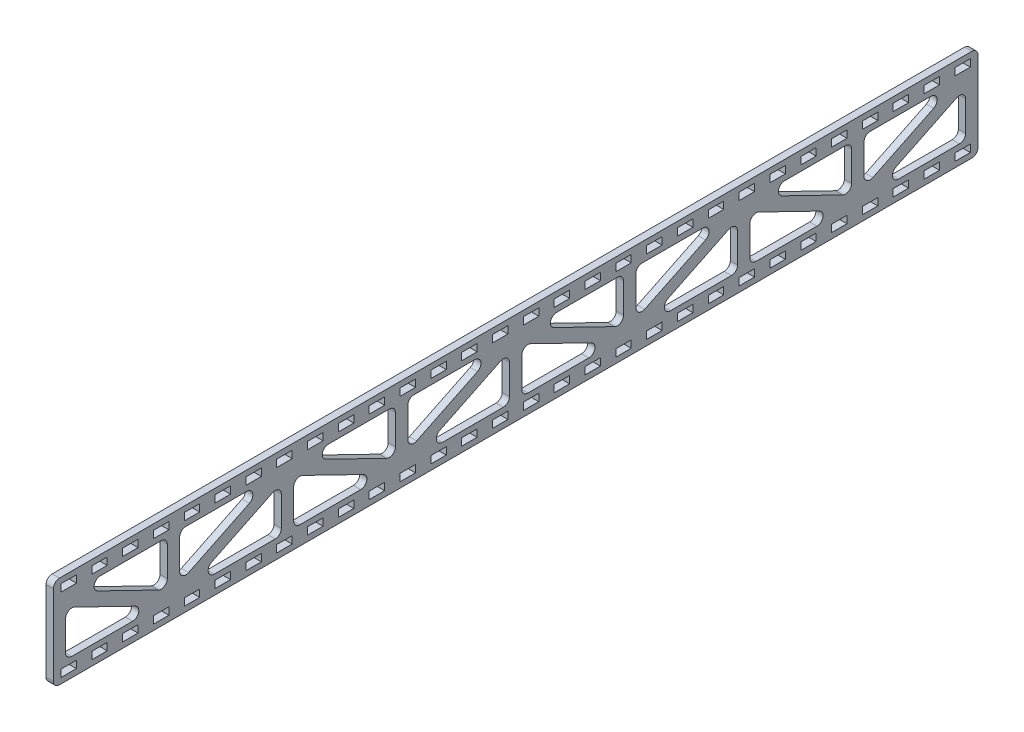
from build123d import *

# Parameters (mm, degrees)
SKETCH1_W          = 381
SKETCH1_H          = 38.1
OUTER_CUT_DEPTH    = 1.4986
CUT_EXTRUDE1_DEPTH = 192.473590105
FILLET1_R          = 2.54
SKETCH2_W          = 6.35
SKETCH2_H          = 3
SLOT_DEPTH         = 192.473590105
SLOTS_COUNT        = 16
SLOTS_PITCH        = 12.7
SLOTS_COUNT_DIR2   = 16
SLOTS_PITCH_DIR2   = 12.7


with BuildPart() as part:
    # Sketch1 → Outer Cut (new, symmetric)
    with BuildSketch(Plane(origin=(0, 0, 0), x_dir=(0, 0, -1), z_dir=(1, 0, 0))):
        Rectangle(SKETCH1_W, SKETCH1_H)
    extrude(amount=OUTER_CUT_DEPTH, both=True)

    # Sketch3 → Cut-Extrude1 (cut, through all)
    with BuildSketch(Plane(origin=(1.4986, 0, 0), x_dir=(0, 0, -1), z_dir=(1, 0, 0))):
        Polygon((-185.42, 7.369701451), (-185.42, -11.43), (-146.776169239, -11.43), align=None)
        Polygon((-143.51, 11.43), (-182.153830761, 11.43), (-143.51, -7.369701451), align=None)
        Polygon((-99.786169239, 11.43), (-138.43, 11.43), (-138.43, -7.369701451), align=None)
        Polygon((-96.52, 7.369701451), (-135.163830761, -11.43), (-96.52, -11.43), align=None)
        Polygon((-91.44, 7.369701451), (-91.44, -11.43), (-52.796169239, -11.43), align=None)
        Polygon((-49.53, 11.43), (-88.173830761, 11.43), (-49.53, -7.369701451), align=None)
        Polygon((-5.806169239, 11.43), (-44.45, 11.43), (-44.45, -7.369701451), align=None)
        Polygon((-41.183830761, -11.43), (-2.54, -11.43), (-2.54, 7.369701451), align=None)
        Polygon((2.54, -11.43), (41.183830761, -11.43), (2.54, 7.369701451), align=None)
        Polygon((44.45, -7.369701451), (44.45, 11.43), (5.806169239, 11.43), align=None)
        Polygon((49.53, -7.369701451), (88.173830761, 11.43), (49.53, 11.43), align=None)
        Polygon((52.796169239, -11.43), (91.44, -11.43), (91.44, 7.369701451), align=None)
        Polygon((96.52, -11.43), (135.163830761, -11.43), (96.52, 7.369701451), align=None)
        Polygon((138.43, -7.369701451), (138.43, 11.43), (99.786169239, 11.43), align=None)
        Polygon((143.51, -7.369701451), (182.153830761, 11.43), (143.51, 11.43), align=None)
        Polygon((146.776169239, -11.43), (185.42, -11.43), (185.42, 7.369701451), align=None)
    extrude(amount=-CUT_EXTRUDE1_DEPTH, mode=Mode.SUBTRACT)

    # Fillet1
    fillet1_edges = [part.edges().sort_by_distance(p)[0] for p in [
        (0, 7.369701451, 91.44),
        (0, -11.43, 52.796169239),
        (0, -11.43, 91.44),
        (0, 11.43, -99.786169239),
        (0, 11.43, -138.43),
        (0, -7.369701451, -138.43),
        (0, -7.369701451, -143.51),
        (0, 11.43, -143.51),
        (0, 11.43, -182.153830761),
        (0, 7.369701451, -185.42),
        (0, -11.43, -185.42),
        (0, -11.43, -146.776169239),
        (0, 11.43, -5.806169239),
        (0, 11.43, -44.45),
        (0, -7.369701451, -44.45),
        (0, -7.369701451, -49.53),
        (0, 11.43, -49.53),
        (0, 11.43, -88.173830761),
        (0, -11.43, -52.796169239),
        (0, 7.369701451, -91.44),
        (0, -11.43, -91.44),
        (0, 7.369701451, -96.52),
        (0, -11.43, -135.163830761),
        (0, -11.43, -96.52),
        (0, 7.369701451, 185.42),
        (0, -11.43, 146.776169239),
        (0, -11.43, 185.42),
        (0, 11.43, 88.173830761),
        (0, 11.43, 49.53),
        (0, -7.369701451, 49.53),
        (0, -7.369701451, 44.45),
        (0, 11.43, 44.45),
        (0, 11.43, 5.806169239),
        (0, -11.43, 41.183830761),
        (0, 7.369701451, 2.54),
        (0, 19.05, 190.5),
        (0, -11.43, 2.54),
        (0, 19.05, -190.5),
        (0, -19.05, -190.5),
        (0, -19.05, 190.5),
        (0, 7.369701451, -2.54),
        (0, -11.43, -41.183830761),
        (0, -11.43, -2.54),
        (0, 11.43, 182.153830761),
        (0, 11.43, 143.51),
        (0, -7.369701451, 143.51),
        (0, -7.369701451, 138.43),
        (0, 11.43, 138.43),
        (0, 11.43, 99.786169239),
        (0, -11.43, 135.163830761),
        (0, 7.369701451, 96.52),
        (0, -11.43, 96.52),
    ]]
    fillet(fillet1_edges, radius=FILLET1_R)

    # Sketch2 → Slot (cut, through all)
    with BuildSketch(Plane(origin=(1.4986, 0, 0), x_dir=(0, 0, -1), z_dir=(1, 0, 0))):
        with Locations((6.35, 15.24)):
            Rectangle(SKETCH2_W, SKETCH2_H)
    slot = extrude(amount=-SLOT_DEPTH, mode=Mode.SUBTRACT)

    # Slots: Slot 16 × 16
    with Locations(*[Vector(0, 0, 1) * (i * SLOTS_PITCH) + Vector(0, 0, -1) * (j * SLOTS_PITCH_DIR2) for i in range(SLOTS_COUNT) for j in range(SLOTS_COUNT_DIR2) if (i, j) != (0, 0)]):
        add(slot, mode=Mode.SUBTRACT)

    # Mirror1: read off the stored shape, not the designer's step
    # Mirror1: loft between two sections, ruled curve by curve
    mirror1_from = [
        Edge.make_line((1.4986, -13.74, -9.525), (1.4986, -16.74, -9.525)),
        Edge.make_line((1.4986, -16.74, -3.175), (1.4986, -13.74, -3.175)),
        Edge.make_line((1.4986, -16.74, -9.525), (1.4986, -16.74, -3.175)),
        Edge.make_line((1.4986, -13.74, -3.175), (1.4986, -13.74, -9.525)),
    ]
    mirror1_to = [
        Edge.make_line((-1.4986, -13.74, -9.525), (-1.4986, -16.74, -9.525)),
        Edge.make_line((-1.4986, -16.74, -3.175), (-1.4986, -13.74, -3.175)),
        Edge.make_line((-1.4986, -16.74, -9.525), (-1.4986, -16.74, -3.175)),
        Edge.make_line((-1.4986, -13.74, -3.175), (-1.4986, -13.74, -9.525)),
    ]
    mirror1 = Solid(Shell([*[Face.make_surface_from_curves(mirror1_from[k], mirror1_to[k]) for k in range(4)], Face(Wire(mirror1_from)), Face(Wire(mirror1_to))]))
    add(mirror1, mode=Mode.SUBTRACT)

    # Mirror1 2: loft between two sections, ruled curve by curve
    mirror1_2_from = [
        Edge.make_line((1.4986, -13.74, -22.225), (1.4986, -16.74, -22.225)),
        Edge.make_line((1.4986, -16.74, -15.875), (1.4986, -13.74, -15.875)),
        Edge.make_line((1.4986, -16.74, -22.225), (1.4986, -16.74, -15.875)),
        Edge.make_line((1.4986, -13.74, -15.875), (1.4986, -13.74, -22.225)),
    ]
    mirror1_2_to = [
        Edge.make_line((-1.4986, -13.74, -22.225), (-1.4986, -16.74, -22.225)),
        Edge.make_line((-1.4986, -16.74, -15.875), (-1.4986, -13.74, -15.875)),
        Edge.make_line((-1.4986, -16.74, -22.225), (-1.4986, -16.74, -15.875)),
        Edge.make_line((-1.4986, -13.74, -15.875), (-1.4986, -13.74, -22.225)),
    ]
    mirror1_2 = Solid(Shell([*[Face.make_surface_from_curves(mirror1_2_from[k], mirror1_2_to[k]) for k in range(4)], Face(Wire(mirror1_2_from)), Face(Wire(mirror1_2_to))]))
    add(mirror1_2, mode=Mode.SUBTRACT)

    # Mirror1 3: loft between two sections, ruled curve by curve
    mirror1_3_from = [
        Edge.make_line((1.4986, -13.74, -136.525), (1.4986, -16.74, -136.525)),
        Edge.make_line((1.4986, -16.74, -130.175), (1.4986, -13.74, -130.175)),
        Edge.make_line((1.4986, -16.74, -136.525), (1.4986, -16.74, -130.175)),
        Edge.make_line((1.4986, -13.74, -130.175), (1.4986, -13.74, -136.525)),
    ]
    mirror1_3_to = [
        Edge.make_line((-1.4986, -13.74, -136.525), (-1.4986, -16.74, -136.525)),
        Edge.make_line((-1.4986, -16.74, -130.175), (-1.4986, -13.74, -130.175)),
        Edge.make_line((-1.4986, -16.74, -136.525), (-1.4986, -16.74, -130.175)),
        Edge.make_line((-1.4986, -13.74, -130.175), (-1.4986, -13.74, -136.525)),
    ]
    mirror1_3 = Solid(Shell([*[Face.make_surface_from_curves(mirror1_3_from[k], mirror1_3_to[k]) for k in range(4)], Face(Wire(mirror1_3_from)), Face(Wire(mirror1_3_to))]))
    add(mirror1_3, mode=Mode.SUBTRACT)

    # Mirror1 4: loft between two sections, ruled curve by curve
    mirror1_4_from = [
        Edge.make_line((1.4986, -13.74, -149.225), (1.4986, -16.74, -149.225)),
        Edge.make_line((1.4986, -16.74, -142.875), (1.4986, -13.74, -142.875)),
        Edge.make_line((1.4986, -16.74, -149.225), (1.4986, -16.74, -142.875)),
        Edge.make_line((1.4986, -13.74, -142.875), (1.4986, -13.74, -149.225)),
    ]
    mirror1_4_to = [
        Edge.make_line((-1.4986, -13.74, -149.225), (-1.4986, -16.74, -149.225)),
        Edge.make_line((-1.4986, -16.74, -142.875), (-1.4986, -13.74, -142.875)),
        Edge.make_line((-1.4986, -16.74, -149.225), (-1.4986, -16.74, -142.875)),
        Edge.make_line((-1.4986, -13.74, -142.875), (-1.4986, -13.74, -149.225)),
    ]
    mirror1_4 = Solid(Shell([*[Face.make_surface_from_curves(mirror1_4_from[k], mirror1_4_to[k]) for k in range(4)], Face(Wire(mirror1_4_from)), Face(Wire(mirror1_4_to))]))
    add(mirror1_4, mode=Mode.SUBTRACT)

    # Mirror1 5: loft between two sections, ruled curve by curve
    mirror1_5_from = [
        Edge.make_line((1.4986, -13.74, -161.925), (1.4986, -16.74, -161.925)),
        Edge.make_line((1.4986, -16.74, -155.575), (1.4986, -13.74, -155.575)),
        Edge.make_line((1.4986, -16.74, -161.925), (1.4986, -16.74, -155.575)),
        Edge.make_line((1.4986, -13.74, -155.575), (1.4986, -13.74, -161.925)),
    ]
    mirror1_5_to = [
        Edge.make_line((-1.4986, -13.74, -161.925), (-1.4986, -16.74, -161.925)),
        Edge.make_line((-1.4986, -16.74, -155.575), (-1.4986, -13.74, -155.575)),
        Edge.make_line((-1.4986, -16.74, -161.925), (-1.4986, -16.74, -155.575)),
        Edge.make_line((-1.4986, -13.74, -155.575), (-1.4986, -13.74, -161.925)),
    ]
    mirror1_5 = Solid(Shell([*[Face.make_surface_from_curves(mirror1_5_from[k], mirror1_5_to[k]) for k in range(4)], Face(Wire(mirror1_5_from)), Face(Wire(mirror1_5_to))]))
    add(mirror1_5, mode=Mode.SUBTRACT)

    # Mirror1 6: loft between two sections, ruled curve by curve
    mirror1_6_from = [
        Edge.make_line((1.4986, -13.74, -174.625), (1.4986, -16.74, -174.625)),
        Edge.make_line((1.4986, -16.74, -168.275), (1.4986, -13.74, -168.275)),
        Edge.make_line((1.4986, -16.74, -174.625), (1.4986, -16.74, -168.275)),
        Edge.make_line((1.4986, -13.74, -168.275), (1.4986, -13.74, -174.625)),
    ]
    mirror1_6_to = [
        Edge.make_line((-1.4986, -13.74, -174.625), (-1.4986, -16.74, -174.625)),
        Edge.make_line((-1.4986, -16.74, -168.275), (-1.4986, -13.74, -168.275)),
        Edge.make_line((-1.4986, -16.74, -174.625), (-1.4986, -16.74, -168.275)),
        Edge.make_line((-1.4986, -13.74, -168.275), (-1.4986, -13.74, -174.625)),
    ]
    mirror1_6 = Solid(Shell([*[Face.make_surface_from_curves(mirror1_6_from[k], mirror1_6_to[k]) for k in range(4)], Face(Wire(mirror1_6_from)), Face(Wire(mirror1_6_to))]))
    add(mirror1_6, mode=Mode.SUBTRACT)

    # Mirror1 7: loft between two sections, ruled curve by curve
    mirror1_7_from = [
        Edge.make_line((1.4986, -13.74, -187.325), (1.4986, -16.74, -187.325)),
        Edge.make_line((1.4986, -16.74, -180.975), (1.4986, -13.74, -180.975)),
        Edge.make_line((1.4986, -16.74, -187.325), (1.4986, -16.74, -180.975)),
        Edge.make_line((1.4986, -13.74, -180.975), (1.4986, -13.74, -187.325)),
    ]
    mirror1_7_to = [
        Edge.make_line((-1.4986, -13.74, -187.325), (-1.4986, -16.74, -187.325)),
        Edge.make_line((-1.4986, -16.74, -180.975), (-1.4986, -13.74, -180.975)),
        Edge.make_line((-1.4986, -16.74, -187.325), (-1.4986, -16.74, -180.975)),
        Edge.make_line((-1.4986, -13.74, -180.975), (-1.4986, -13.74, -187.325)),
    ]
    mirror1_7 = Solid(Shell([*[Face.make_surface_from_curves(mirror1_7_from[k], mirror1_7_to[k]) for k in range(4)], Face(Wire(mirror1_7_from)), Face(Wire(mirror1_7_to))]))
    add(mirror1_7, mode=Mode.SUBTRACT)

    # Mirror1 8: loft between two sections, ruled curve by curve
    mirror1_8_from = [
        Edge.make_line((1.4986, -13.74, 3.175), (1.4986, -16.74, 3.175)),
        Edge.make_line((1.4986, -16.74, 9.525), (1.4986, -13.74, 9.525)),
        Edge.make_line((1.4986, -16.74, 3.175), (1.4986, -16.74, 9.525)),
        Edge.make_line((1.4986, -13.74, 9.525), (1.4986, -13.74, 3.175)),
    ]
    mirror1_8_to = [
        Edge.make_line((-1.4986, -13.74, 3.175), (-1.4986, -16.74, 3.175)),
        Edge.make_line((-1.4986, -16.74, 9.525), (-1.4986, -13.74, 9.525)),
        Edge.make_line((-1.4986, -16.74, 3.175), (-1.4986, -16.74, 9.525)),
        Edge.make_line((-1.4986, -13.74, 9.525), (-1.4986, -13.74, 3.175)),
    ]
    mirror1_8 = Solid(Shell([*[Face.make_surface_from_curves(mirror1_8_from[k], mirror1_8_to[k]) for k in range(4)], Face(Wire(mirror1_8_from)), Face(Wire(mirror1_8_to))]))
    add(mirror1_8, mode=Mode.SUBTRACT)

    # Mirror1 9: loft between two sections, ruled curve by curve
    mirror1_9_from = [
        Edge.make_line((1.4986, -13.74, 15.875), (1.4986, -16.74, 15.875)),
        Edge.make_line((1.4986, -16.74, 22.225), (1.4986, -13.74, 22.225)),
        Edge.make_line((1.4986, -16.74, 15.875), (1.4986, -16.74, 22.225)),
        Edge.make_line((1.4986, -13.74, 22.225), (1.4986, -13.74, 15.875)),
    ]
    mirror1_9_to = [
        Edge.make_line((-1.4986, -13.74, 15.875), (-1.4986, -16.74, 15.875)),
        Edge.make_line((-1.4986, -16.74, 22.225), (-1.4986, -13.74, 22.225)),
        Edge.make_line((-1.4986, -16.74, 15.875), (-1.4986, -16.74, 22.225)),
        Edge.make_line((-1.4986, -13.74, 22.225), (-1.4986, -13.74, 15.875)),
    ]
    mirror1_9 = Solid(Shell([*[Face.make_surface_from_curves(mirror1_9_from[k], mirror1_9_to[k]) for k in range(4)], Face(Wire(mirror1_9_from)), Face(Wire(mirror1_9_to))]))
    add(mirror1_9, mode=Mode.SUBTRACT)

    # Mirror1 10: loft between two sections, ruled curve by curve
    mirror1_10_from = [
        Edge.make_line((1.4986, -13.74, -123.825), (1.4986, -16.74, -123.825)),
        Edge.make_line((1.4986, -16.74, -117.475), (1.4986, -13.74, -117.475)),
        Edge.make_line((1.4986, -16.74, -123.825), (1.4986, -16.74, -117.475)),
        Edge.make_line((1.4986, -13.74, -117.475), (1.4986, -13.74, -123.825)),
    ]
    mirror1_10_to = [
        Edge.make_line((-1.4986, -13.74, -123.825), (-1.4986, -16.74, -123.825)),
        Edge.make_line((-1.4986, -16.74, -117.475), (-1.4986, -13.74, -117.475)),
        Edge.make_line((-1.4986, -16.74, -123.825), (-1.4986, -16.74, -117.475)),
        Edge.make_line((-1.4986, -13.74, -117.475), (-1.4986, -13.74, -123.825)),
    ]
    mirror1_10 = Solid(Shell([*[Face.make_surface_from_curves(mirror1_10_from[k], mirror1_10_to[k]) for k in range(4)], Face(Wire(mirror1_10_from)), Face(Wire(mirror1_10_to))]))
    add(mirror1_10, mode=Mode.SUBTRACT)

    # Mirror1 11: loft between two sections, ruled curve by curve
    mirror1_11_from = [
        Edge.make_line((1.4986, -13.74, -111.125), (1.4986, -16.74, -111.125)),
        Edge.make_line((1.4986, -16.74, -104.775), (1.4986, -13.74, -104.775)),
        Edge.make_line((1.4986, -16.74, -111.125), (1.4986, -16.74, -104.775)),
        Edge.make_line((1.4986, -13.74, -104.775), (1.4986, -13.74, -111.125)),
    ]
    mirror1_11_to = [
        Edge.make_line((-1.4986, -13.74, -111.125), (-1.4986, -16.74, -111.125)),
        Edge.make_line((-1.4986, -16.74, -104.775), (-1.4986, -13.74, -104.775)),
        Edge.make_line((-1.4986, -16.74, -111.125), (-1.4986, -16.74, -104.775)),
        Edge.make_line((-1.4986, -13.74, -104.775), (-1.4986, -13.74, -111.125)),
    ]
    mirror1_11 = Solid(Shell([*[Face.make_surface_from_curves(mirror1_11_from[k], mirror1_11_to[k]) for k in range(4)], Face(Wire(mirror1_11_from)), Face(Wire(mirror1_11_to))]))
    add(mirror1_11, mode=Mode.SUBTRACT)

    # Mirror1 12: loft between two sections, ruled curve by curve
    mirror1_12_from = [
        Edge.make_line((1.4986, -13.74, -98.425), (1.4986, -16.74, -98.425)),
        Edge.make_line((1.4986, -16.74, -92.075), (1.4986, -13.74, -92.075)),
        Edge.make_line((1.4986, -16.74, -98.425), (1.4986, -16.74, -92.075)),
        Edge.make_line((1.4986, -13.74, -92.075), (1.4986, -13.74, -98.425)),
    ]
    mirror1_12_to = [
        Edge.make_line((-1.4986, -13.74, -98.425), (-1.4986, -16.74, -98.425)),
        Edge.make_line((-1.4986, -16.74, -92.075), (-1.4986, -13.74, -92.075)),
        Edge.make_line((-1.4986, -16.74, -98.425), (-1.4986, -16.74, -92.075)),
        Edge.make_line((-1.4986, -13.74, -92.075), (-1.4986, -13.74, -98.425)),
    ]
    mirror1_12 = Solid(Shell([*[Face.make_surface_from_curves(mirror1_12_from[k], mirror1_12_to[k]) for k in range(4)], Face(Wire(mirror1_12_from)), Face(Wire(mirror1_12_to))]))
    add(mirror1_12, mode=Mode.SUBTRACT)

    # Mirror1 13: loft between two sections, ruled curve by curve
    mirror1_13_from = [
        Edge.make_line((1.4986, -13.74, -85.725), (1.4986, -16.74, -85.725)),
        Edge.make_line((1.4986, -16.74, -79.375), (1.4986, -13.74, -79.375)),
        Edge.make_line((1.4986, -16.74, -85.725), (1.4986, -16.74, -79.375)),
        Edge.make_line((1.4986, -13.74, -79.375), (1.4986, -13.74, -85.725)),
    ]
    mirror1_13_to = [
        Edge.make_line((-1.4986, -13.74, -85.725), (-1.4986, -16.74, -85.725)),
        Edge.make_line((-1.4986, -16.74, -79.375), (-1.4986, -13.74, -79.375)),
        Edge.make_line((-1.4986, -16.74, -85.725), (-1.4986, -16.74, -79.375)),
        Edge.make_line((-1.4986, -13.74, -79.375), (-1.4986, -13.74, -85.725)),
    ]
    mirror1_13 = Solid(Shell([*[Face.make_surface_from_curves(mirror1_13_from[k], mirror1_13_to[k]) for k in range(4)], Face(Wire(mirror1_13_from)), Face(Wire(mirror1_13_to))]))
    add(mirror1_13, mode=Mode.SUBTRACT)

    # Mirror1 14: loft between two sections, ruled curve by curve
    mirror1_14_from = [
        Edge.make_line((1.4986, -13.74, -73.025), (1.4986, -16.74, -73.025)),
        Edge.make_line((1.4986, -16.74, -66.675), (1.4986, -13.74, -66.675)),
        Edge.make_line((1.4986, -16.74, -73.025), (1.4986, -16.74, -66.675)),
        Edge.make_line((1.4986, -13.74, -66.675), (1.4986, -13.74, -73.025)),
    ]
    mirror1_14_to = [
        Edge.make_line((-1.4986, -13.74, -73.025), (-1.4986, -16.74, -73.025)),
        Edge.make_line((-1.4986, -16.74, -66.675), (-1.4986, -13.74, -66.675)),
        Edge.make_line((-1.4986, -16.74, -73.025), (-1.4986, -16.74, -66.675)),
        Edge.make_line((-1.4986, -13.74, -66.675), (-1.4986, -13.74, -73.025)),
    ]
    mirror1_14 = Solid(Shell([*[Face.make_surface_from_curves(mirror1_14_from[k], mirror1_14_to[k]) for k in range(4)], Face(Wire(mirror1_14_from)), Face(Wire(mirror1_14_to))]))
    add(mirror1_14, mode=Mode.SUBTRACT)

    # Mirror1 15: loft between two sections, ruled curve by curve
    mirror1_15_from = [
        Edge.make_line((1.4986, -13.74, -60.325), (1.4986, -16.74, -60.325)),
        Edge.make_line((1.4986, -16.74, -53.975), (1.4986, -13.74, -53.975)),
        Edge.make_line((1.4986, -16.74, -60.325), (1.4986, -16.74, -53.975)),
        Edge.make_line((1.4986, -13.74, -53.975), (1.4986, -13.74, -60.325)),
    ]
    mirror1_15_to = [
        Edge.make_line((-1.4986, -13.74, -60.325), (-1.4986, -16.74, -60.325)),
        Edge.make_line((-1.4986, -16.74, -53.975), (-1.4986, -13.74, -53.975)),
        Edge.make_line((-1.4986, -16.74, -60.325), (-1.4986, -16.74, -53.975)),
        Edge.make_line((-1.4986, -13.74, -53.975), (-1.4986, -13.74, -60.325)),
    ]
    mirror1_15 = Solid(Shell([*[Face.make_surface_from_curves(mirror1_15_from[k], mirror1_15_to[k]) for k in range(4)], Face(Wire(mirror1_15_from)), Face(Wire(mirror1_15_to))]))
    add(mirror1_15, mode=Mode.SUBTRACT)

    # Mirror1 16: loft between two sections, ruled curve by curve
    mirror1_16_from = [
        Edge.make_line((1.4986, -13.74, -47.625), (1.4986, -16.74, -47.625)),
        Edge.make_line((1.4986, -16.74, -41.275), (1.4986, -13.74, -41.275)),
        Edge.make_line((1.4986, -16.74, -47.625), (1.4986, -16.74, -41.275)),
        Edge.make_line((1.4986, -13.74, -41.275), (1.4986, -13.74, -47.625)),
    ]
    mirror1_16_to = [
        Edge.make_line((-1.4986, -13.74, -47.625), (-1.4986, -16.74, -47.625)),
        Edge.make_line((-1.4986, -16.74, -41.275), (-1.4986, -13.74, -41.275)),
        Edge.make_line((-1.4986, -16.74, -47.625), (-1.4986, -16.74, -41.275)),
        Edge.make_line((-1.4986, -13.74, -41.275), (-1.4986, -13.74, -47.625)),
    ]
    mirror1_16 = Solid(Shell([*[Face.make_surface_from_curves(mirror1_16_from[k], mirror1_16_to[k]) for k in range(4)], Face(Wire(mirror1_16_from)), Face(Wire(mirror1_16_to))]))
    add(mirror1_16, mode=Mode.SUBTRACT)

    # Mirror1 17: loft between two sections, ruled curve by curve
    mirror1_17_from = [
        Edge.make_line((1.4986, -13.74, -34.925), (1.4986, -16.74, -34.925)),
        Edge.make_line((1.4986, -16.74, -28.575), (1.4986, -13.74, -28.575)),
        Edge.make_line((1.4986, -16.74, -34.925), (1.4986, -16.74, -28.575)),
        Edge.make_line((1.4986, -13.74, -28.575), (1.4986, -13.74, -34.925)),
    ]
    mirror1_17_to = [
        Edge.make_line((-1.4986, -13.74, -34.925), (-1.4986, -16.74, -34.925)),
        Edge.make_line((-1.4986, -16.74, -28.575), (-1.4986, -13.74, -28.575)),
        Edge.make_line((-1.4986, -16.74, -34.925), (-1.4986, -16.74, -28.575)),
        Edge.make_line((-1.4986, -13.74, -28.575), (-1.4986, -13.74, -34.925)),
    ]
    mirror1_17 = Solid(Shell([*[Face.make_surface_from_curves(mirror1_17_from[k], mirror1_17_to[k]) for k in range(4)], Face(Wire(mirror1_17_from)), Face(Wire(mirror1_17_to))]))
    add(mirror1_17, mode=Mode.SUBTRACT)

    # Mirror1 18: loft between two sections, ruled curve by curve
    mirror1_18_from = [
        Edge.make_line((1.4986, -13.74, 28.575), (1.4986, -16.74, 28.575)),
        Edge.make_line((1.4986, -16.74, 34.925), (1.4986, -13.74, 34.925)),
        Edge.make_line((1.4986, -16.74, 28.575), (1.4986, -16.74, 34.925)),
        Edge.make_line((1.4986, -13.74, 34.925), (1.4986, -13.74, 28.575)),
    ]
    mirror1_18_to = [
        Edge.make_line((-1.4986, -13.74, 28.575), (-1.4986, -16.74, 28.575)),
        Edge.make_line((-1.4986, -16.74, 34.925), (-1.4986, -13.74, 34.925)),
        Edge.make_line((-1.4986, -16.74, 28.575), (-1.4986, -16.74, 34.925)),
        Edge.make_line((-1.4986, -13.74, 34.925), (-1.4986, -13.74, 28.575)),
    ]
    mirror1_18 = Solid(Shell([*[Face.make_surface_from_curves(mirror1_18_from[k], mirror1_18_to[k]) for k in range(4)], Face(Wire(mirror1_18_from)), Face(Wire(mirror1_18_to))]))
    add(mirror1_18, mode=Mode.SUBTRACT)

    # Mirror1 19: loft between two sections, ruled curve by curve
    mirror1_19_from = [
        Edge.make_line((1.4986, -13.74, 41.275), (1.4986, -16.74, 41.275)),
        Edge.make_line((1.4986, -16.74, 47.625), (1.4986, -13.74, 47.625)),
        Edge.make_line((1.4986, -16.74, 41.275), (1.4986, -16.74, 47.625)),
        Edge.make_line((1.4986, -13.74, 47.625), (1.4986, -13.74, 41.275)),
    ]
    mirror1_19_to = [
        Edge.make_line((-1.4986, -13.74, 41.275), (-1.4986, -16.74, 41.275)),
        Edge.make_line((-1.4986, -16.74, 47.625), (-1.4986, -13.74, 47.625)),
        Edge.make_line((-1.4986, -16.74, 41.275), (-1.4986, -16.74, 47.625)),
        Edge.make_line((-1.4986, -13.74, 47.625), (-1.4986, -13.74, 41.275)),
    ]
    mirror1_19 = Solid(Shell([*[Face.make_surface_from_curves(mirror1_19_from[k], mirror1_19_to[k]) for k in range(4)], Face(Wire(mirror1_19_from)), Face(Wire(mirror1_19_to))]))
    add(mirror1_19, mode=Mode.SUBTRACT)

    # Mirror1 20: loft between two sections, ruled curve by curve
    mirror1_20_from = [
        Edge.make_line((1.4986, -13.74, 53.975), (1.4986, -16.74, 53.975)),
        Edge.make_line((1.4986, -16.74, 60.325), (1.4986, -13.74, 60.325)),
        Edge.make_line((1.4986, -16.74, 53.975), (1.4986, -16.74, 60.325)),
        Edge.make_line((1.4986, -13.74, 60.325), (1.4986, -13.74, 53.975)),
    ]
    mirror1_20_to = [
        Edge.make_line((-1.4986, -13.74, 53.975), (-1.4986, -16.74, 53.975)),
        Edge.make_line((-1.4986, -16.74, 60.325), (-1.4986, -13.74, 60.325)),
        Edge.make_line((-1.4986, -16.74, 53.975), (-1.4986, -16.74, 60.325)),
        Edge.make_line((-1.4986, -13.74, 60.325), (-1.4986, -13.74, 53.975)),
    ]
    mirror1_20 = Solid(Shell([*[Face.make_surface_from_curves(mirror1_20_from[k], mirror1_20_to[k]) for k in range(4)], Face(Wire(mirror1_20_from)), Face(Wire(mirror1_20_to))]))
    add(mirror1_20, mode=Mode.SUBTRACT)

    # Mirror1 21: loft between two sections, ruled curve by curve
    mirror1_21_from = [
        Edge.make_line((1.4986, -13.74, 66.675), (1.4986, -16.74, 66.675)),
        Edge.make_line((1.4986, -16.74, 73.025), (1.4986, -13.74, 73.025)),
        Edge.make_line((1.4986, -16.74, 66.675), (1.4986, -16.74, 73.025)),
        Edge.make_line((1.4986, -13.74, 73.025), (1.4986, -13.74, 66.675)),
    ]
    mirror1_21_to = [
        Edge.make_line((-1.4986, -13.74, 66.675), (-1.4986, -16.74, 66.675)),
        Edge.make_line((-1.4986, -16.74, 73.025), (-1.4986, -13.74, 73.025)),
        Edge.make_line((-1.4986, -16.74, 66.675), (-1.4986, -16.74, 73.025)),
        Edge.make_line((-1.4986, -13.74, 73.025), (-1.4986, -13.74, 66.675)),
    ]
    mirror1_21 = Solid(Shell([*[Face.make_surface_from_curves(mirror1_21_from[k], mirror1_21_to[k]) for k in range(4)], Face(Wire(mirror1_21_from)), Face(Wire(mirror1_21_to))]))
    add(mirror1_21, mode=Mode.SUBTRACT)

    # Mirror1 22: loft between two sections, ruled curve by curve
    mirror1_22_from = [
        Edge.make_line((1.4986, -13.74, 79.375), (1.4986, -16.74, 79.375)),
        Edge.make_line((1.4986, -16.74, 85.725), (1.4986, -13.74, 85.725)),
        Edge.make_line((1.4986, -16.74, 79.375), (1.4986, -16.74, 85.725)),
        Edge.make_line((1.4986, -13.74, 85.725), (1.4986, -13.74, 79.375)),
    ]
    mirror1_22_to = [
        Edge.make_line((-1.4986, -13.74, 79.375), (-1.4986, -16.74, 79.375)),
        Edge.make_line((-1.4986, -16.74, 85.725), (-1.4986, -13.74, 85.725)),
        Edge.make_line((-1.4986, -16.74, 79.375), (-1.4986, -16.74, 85.725)),
        Edge.make_line((-1.4986, -13.74, 85.725), (-1.4986, -13.74, 79.375)),
    ]
    mirror1_22 = Solid(Shell([*[Face.make_surface_from_curves(mirror1_22_from[k], mirror1_22_to[k]) for k in range(4)], Face(Wire(mirror1_22_from)), Face(Wire(mirror1_22_to))]))
    add(mirror1_22, mode=Mode.SUBTRACT)

    # Mirror1 23: loft between two sections, ruled curve by curve
    mirror1_23_from = [
        Edge.make_line((1.4986, -13.74, 92.075), (1.4986, -16.74, 92.075)),
        Edge.make_line((1.4986, -16.74, 98.425), (1.4986, -13.74, 98.425)),
        Edge.make_line((1.4986, -16.74, 92.075), (1.4986, -16.74, 98.425)),
        Edge.make_line((1.4986, -13.74, 98.425), (1.4986, -13.74, 92.075)),
    ]
    mirror1_23_to = [
        Edge.make_line((-1.4986, -13.74, 92.075), (-1.4986, -16.74, 92.075)),
        Edge.make_line((-1.4986, -16.74, 98.425), (-1.4986, -13.74, 98.425)),
        Edge.make_line((-1.4986, -16.74, 92.075), (-1.4986, -16.74, 98.425)),
        Edge.make_line((-1.4986, -13.74, 98.425), (-1.4986, -13.74, 92.075)),
    ]
    mirror1_23 = Solid(Shell([*[Face.make_surface_from_curves(mirror1_23_from[k], mirror1_23_to[k]) for k in range(4)], Face(Wire(mirror1_23_from)), Face(Wire(mirror1_23_to))]))
    add(mirror1_23, mode=Mode.SUBTRACT)

    # Mirror1 24: loft between two sections, ruled curve by curve
    mirror1_24_from = [
        Edge.make_line((1.4986, -13.74, 104.775), (1.4986, -16.74, 104.775)),
        Edge.make_line((1.4986, -16.74, 111.125), (1.4986, -13.74, 111.125)),
        Edge.make_line((1.4986, -16.74, 104.775), (1.4986, -16.74, 111.125)),
        Edge.make_line((1.4986, -13.74, 111.125), (1.4986, -13.74, 104.775)),
    ]
    mirror1_24_to = [
        Edge.make_line((-1.4986, -13.74, 104.775), (-1.4986, -16.74, 104.775)),
        Edge.make_line((-1.4986, -16.74, 111.125), (-1.4986, -13.74, 111.125)),
        Edge.make_line((-1.4986, -16.74, 104.775), (-1.4986, -16.74, 111.125)),
        Edge.make_line((-1.4986, -13.74, 111.125), (-1.4986, -13.74, 104.775)),
    ]
    mirror1_24 = Solid(Shell([*[Face.make_surface_from_curves(mirror1_24_from[k], mirror1_24_to[k]) for k in range(4)], Face(Wire(mirror1_24_from)), Face(Wire(mirror1_24_to))]))
    add(mirror1_24, mode=Mode.SUBTRACT)

    # Mirror1 25: loft between two sections, ruled curve by curve
    mirror1_25_from = [
        Edge.make_line((1.4986, -13.74, 117.475), (1.4986, -16.74, 117.475)),
        Edge.make_line((1.4986, -16.74, 123.825), (1.4986, -13.74, 123.825)),
        Edge.make_line((1.4986, -16.74, 117.475), (1.4986, -16.74, 123.825)),
        Edge.make_line((1.4986, -13.74, 123.825), (1.4986, -13.74, 117.475)),
    ]
    mirror1_25_to = [
        Edge.make_line((-1.4986, -13.74, 117.475), (-1.4986, -16.74, 117.475)),
        Edge.make_line((-1.4986, -16.74, 123.825), (-1.4986, -13.74, 123.825)),
        Edge.make_line((-1.4986, -16.74, 117.475), (-1.4986, -16.74, 123.825)),
        Edge.make_line((-1.4986, -13.74, 123.825), (-1.4986, -13.74, 117.475)),
    ]
    mirror1_25 = Solid(Shell([*[Face.make_surface_from_curves(mirror1_25_from[k], mirror1_25_to[k]) for k in range(4)], Face(Wire(mirror1_25_from)), Face(Wire(mirror1_25_to))]))
    add(mirror1_25, mode=Mode.SUBTRACT)

    # Mirror1 26: loft between two sections, ruled curve by curve
    mirror1_26_from = [
        Edge.make_line((1.4986, -13.74, 130.175), (1.4986, -16.74, 130.175)),
        Edge.make_line((1.4986, -16.74, 136.525), (1.4986, -13.74, 136.525)),
        Edge.make_line((1.4986, -16.74, 130.175), (1.4986, -16.74, 136.525)),
        Edge.make_line((1.4986, -13.74, 136.525), (1.4986, -13.74, 130.175)),
    ]
    mirror1_26_to = [
        Edge.make_line((-1.4986, -13.74, 130.175), (-1.4986, -16.74, 130.175)),
        Edge.make_line((-1.4986, -16.74, 136.525), (-1.4986, -13.74, 136.525)),
        Edge.make_line((-1.4986, -16.74, 130.175), (-1.4986, -16.74, 136.525)),
        Edge.make_line((-1.4986, -13.74, 136.525), (-1.4986, -13.74, 130.175)),
    ]
    mirror1_26 = Solid(Shell([*[Face.make_surface_from_curves(mirror1_26_from[k], mirror1_26_to[k]) for k in range(4)], Face(Wire(mirror1_26_from)), Face(Wire(mirror1_26_to))]))
    add(mirror1_26, mode=Mode.SUBTRACT)

    # Mirror1 27: loft between two sections, ruled curve by curve
    mirror1_27_from = [
        Edge.make_line((1.4986, -13.74, 142.875), (1.4986, -16.74, 142.875)),
        Edge.make_line((1.4986, -16.74, 149.225), (1.4986, -13.74, 149.225)),
        Edge.make_line((1.4986, -16.74, 142.875), (1.4986, -16.74, 149.225)),
        Edge.make_line((1.4986, -13.74, 149.225), (1.4986, -13.74, 142.875)),
    ]
    mirror1_27_to = [
        Edge.make_line((-1.4986, -13.74, 142.875), (-1.4986, -16.74, 142.875)),
        Edge.make_line((-1.4986, -16.74, 149.225), (-1.4986, -13.74, 149.225)),
        Edge.make_line((-1.4986, -16.74, 142.875), (-1.4986, -16.74, 149.225)),
        Edge.make_line((-1.4986, -13.74, 149.225), (-1.4986, -13.74, 142.875)),
    ]
    mirror1_27 = Solid(Shell([*[Face.make_surface_from_curves(mirror1_27_from[k], mirror1_27_to[k]) for k in range(4)], Face(Wire(mirror1_27_from)), Face(Wire(mirror1_27_to))]))
    add(mirror1_27, mode=Mode.SUBTRACT)

    # Mirror1 28: loft between two sections, ruled curve by curve
    mirror1_28_from = [
        Edge.make_line((1.4986, -13.74, 155.575), (1.4986, -16.74, 155.575)),
        Edge.make_line((1.4986, -16.74, 161.925), (1.4986, -13.74, 161.925)),
        Edge.make_line((1.4986, -16.74, 155.575), (1.4986, -16.74, 161.925)),
        Edge.make_line((1.4986, -13.74, 161.925), (1.4986, -13.74, 155.575)),
    ]
    mirror1_28_to = [
        Edge.make_line((-1.4986, -13.74, 155.575), (-1.4986, -16.74, 155.575)),
        Edge.make_line((-1.4986, -16.74, 161.925), (-1.4986, -13.74, 161.925)),
        Edge.make_line((-1.4986, -16.74, 155.575), (-1.4986, -16.74, 161.925)),
        Edge.make_line((-1.4986, -13.74, 161.925), (-1.4986, -13.74, 155.575)),
    ]
    mirror1_28 = Solid(Shell([*[Face.make_surface_from_curves(mirror1_28_from[k], mirror1_28_to[k]) for k in range(4)], Face(Wire(mirror1_28_from)), Face(Wire(mirror1_28_to))]))
    add(mirror1_28, mode=Mode.SUBTRACT)

    # Mirror1 29: loft between two sections, ruled curve by curve
    mirror1_29_from = [
        Edge.make_line((1.4986, -13.74, 168.275), (1.4986, -16.74, 168.275)),
        Edge.make_line((1.4986, -16.74, 174.625), (1.4986, -13.74, 174.625)),
        Edge.make_line((1.4986, -16.74, 168.275), (1.4986, -16.74, 174.625)),
        Edge.make_line((1.4986, -13.74, 174.625), (1.4986, -13.74, 168.275)),
    ]
    mirror1_29_to = [
        Edge.make_line((-1.4986, -13.74, 168.275), (-1.4986, -16.74, 168.275)),
        Edge.make_line((-1.4986, -16.74, 174.625), (-1.4986, -13.74, 174.625)),
        Edge.make_line((-1.4986, -16.74, 168.275), (-1.4986, -16.74, 174.625)),
        Edge.make_line((-1.4986, -13.74, 174.625), (-1.4986, -13.74, 168.275)),
    ]
    mirror1_29 = Solid(Shell([*[Face.make_surface_from_curves(mirror1_29_from[k], mirror1_29_to[k]) for k in range(4)], Face(Wire(mirror1_29_from)), Face(Wire(mirror1_29_to))]))
    add(mirror1_29, mode=Mode.SUBTRACT)

    # Mirror1 30: loft between two sections, ruled curve by curve
    mirror1_30_from = [
        Edge.make_line((1.4986, -13.74, 180.975), (1.4986, -16.74, 180.975)),
        Edge.make_line((1.4986, -16.74, 187.325), (1.4986, -13.74, 187.325)),
        Edge.make_line((1.4986, -16.74, 180.975), (1.4986, -16.74, 187.325)),
        Edge.make_line((1.4986, -13.74, 187.325), (1.4986, -13.74, 180.975)),
    ]
    mirror1_30_to = [
        Edge.make_line((-1.4986, -13.74, 180.975), (-1.4986, -16.74, 180.975)),
        Edge.make_line((-1.4986, -16.74, 187.325), (-1.4986, -13.74, 187.325)),
        Edge.make_line((-1.4986, -16.74, 180.975), (-1.4986, -16.74, 187.325)),
        Edge.make_line((-1.4986, -13.74, 187.325), (-1.4986, -13.74, 180.975)),
    ]
    mirror1_30 = Solid(Shell([*[Face.make_surface_from_curves(mirror1_30_from[k], mirror1_30_to[k]) for k in range(4)], Face(Wire(mirror1_30_from)), Face(Wire(mirror1_30_to))]))
    add(mirror1_30, mode=Mode.SUBTRACT)


solid = part.part
